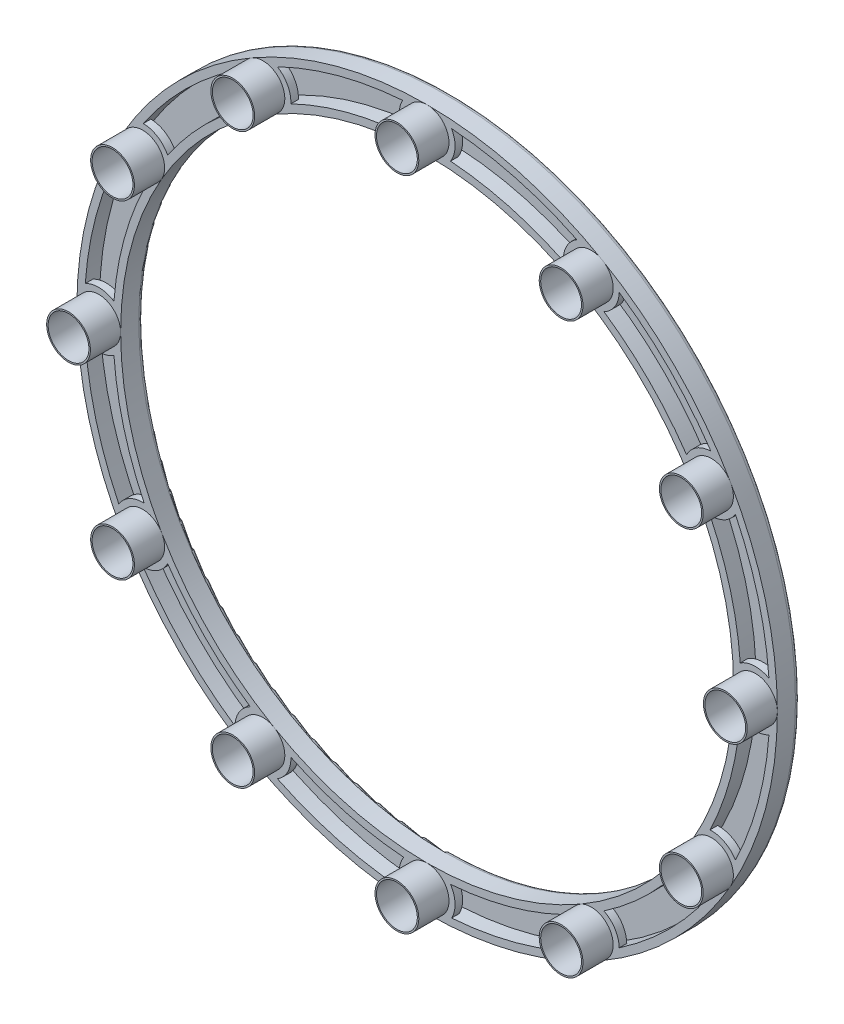
from build123d import *

# Parameters (mm, degrees)
SKETCH1_R                        = 36.83
BOSS_EXTRUDE8_DEPTH              = 50.8
BOSS_EXTRUDE8_2_DEPTH            = 50.8
BOSS_EXTRUDE8_3_DEPTH            = 50.8
BOSS_EXTRUDE8_4_DEPTH            = 50.8
BOSS_EXTRUDE8_5_DEPTH            = 50.8
BOSS_EXTRUDE8_6_DEPTH            = 50.8
BOSS_EXTRUDE8_7_DEPTH            = 50.8
BOSS_EXTRUDE8_8_DEPTH            = 50.8
BOSS_EXTRUDE8_9_DEPTH            = 50.8
BOSS_EXTRUDE8_10_DEPTH           = 50.8
BOSS_EXTRUDE8_11_DEPTH           = 50.8
BOSS_EXTRUDE8_12_DEPTH           = 50.8
SKETCH14_W                       = 34.330005
SKETCH14_H                       = 71.12
F_1_1_DIAMETER_HOLE1_AT_2_COUNT  = 2
F_1_1_DIAMETER_HOLE1_AT_2_PITCH  = 285.969162934
F_1_1_DIAMETER_HOLE1_AT_3_COUNT  = 2
F_1_1_DIAMETER_HOLE1_AT_3_PITCH  = 552.45
F_1_1_DIAMETER_HOLE1_AT_4_COUNT  = 2
F_1_1_DIAMETER_HOLE1_AT_4_PITCH  = 781.282282533
F_1_1_DIAMETER_HOLE1_AT_5_COUNT  = 2
F_1_1_DIAMETER_HOLE1_AT_5_PITCH  = 956.871468641
F_1_1_DIAMETER_HOLE1_AT_6_COUNT  = 2
F_1_1_DIAMETER_HOLE1_AT_6_PITCH  = 1067.251445467
F_1_1_DIAMETER_HOLE1_AT_7_COUNT  = 2
F_1_1_DIAMETER_HOLE1_AT_7_PITCH  = 1104.9
F_1_1_DIAMETER_HOLE1_AT_8_COUNT  = 2
F_1_1_DIAMETER_HOLE1_AT_8_PITCH  = 1067.251445467
F_1_1_DIAMETER_HOLE1_AT_9_COUNT  = 2
F_1_1_DIAMETER_HOLE1_AT_9_PITCH  = 956.871468641
F_1_1_DIAMETER_HOLE1_AT_10_COUNT = 2
F_1_1_DIAMETER_HOLE1_AT_10_PITCH = 781.282282533
F_1_1_DIAMETER_HOLE1_AT_11_COUNT = 2
F_1_1_DIAMETER_HOLE1_AT_11_PITCH = 552.45
F_1_1_DIAMETER_HOLE1_AT_12_COUNT = 2
F_1_1_DIAMETER_HOLE1_AT_12_PITCH = 285.969162934
SKETCH7_R                        = 589.28
SKETCH7_R_2                      = 515.62
BOSS_EXTRUDE9_DEPTH              = 38.1
FILLET1_R                        = 7.62
SHELL1_START                     = 50.8
SHELL1_DEPTH                     = 25.4
SHELL1_START_2                   = 63.5
SHELL1_2_DEPTH                   = 12.7
F_1_1_DIAMETER_HOLE2_D           = 68.66001
F_1_1_DIAMETER_HOLE2_DEPTH       = 12.7
SCALE3_SCALE                     = 0.97
SCALE5_SCALE                     = 1.01
SCALE8_SCALE                     = 0.98
BODY_MOVE_COPY1_ANGLE            = 180


# Read off the part's stored shape, not the designer's step: Shell1
with BuildPart() as part:
    # Sketch1 → Boss-Extrude8 (new body)
    with BuildSketch(Plane.XY):
        with Locations((0, 552.45)):
            Circle(SKETCH1_R)
    extrude(amount=BOSS_EXTRUDE8_DEPTH)


with BuildPart() as body_2:
    # Sketch1 → Boss-Extrude8 2 (new body)
    with BuildSketch(Plane.XY):
        with Locations((276.225, 478.435734321)):
            Circle(SKETCH1_R)
    extrude(amount=BOSS_EXTRUDE8_2_DEPTH)


with BuildPart() as body_3:
    # Sketch1 → Boss-Extrude8 3 (new body)
    with BuildSketch(Plane.XY):
        with Locations((478.435734321, 276.225)):
            Circle(SKETCH1_R)
    extrude(amount=BOSS_EXTRUDE8_3_DEPTH)


with BuildPart() as body_4:
    # Sketch1 → Boss-Extrude8 4 (new body)
    with BuildSketch(Plane.XY):
        with Locations((552.45, 0)):
            Circle(SKETCH1_R)
    extrude(amount=BOSS_EXTRUDE8_4_DEPTH)


with BuildPart() as body_5:
    # Sketch1 → Boss-Extrude8 5 (new body)
    with BuildSketch(Plane.XY):
        with Locations((478.435734321, -276.225)):
            Circle(SKETCH1_R)
    extrude(amount=BOSS_EXTRUDE8_5_DEPTH)

    # Sketch14 → 1 (1) Diameter Hole1 (revolve, cut)
    with BuildSketch(Plane(origin=(478.435734321, -276.225, 50.8), x_dir=(0, -1, 0), z_dir=(1, 0, 0))):
        with Locations((17.1650025, 35.56)):
            Rectangle(SKETCH14_W, SKETCH14_H)
    f_1_1_diameter_hole1 = revolve(axis=Axis((478.435734321, -276.225, 57.15), (0, 0, -1)), mode=Mode.SUBTRACT)


with BuildPart() as body_6:
    # Sketch1 → Boss-Extrude8 6 (new body)
    with BuildSketch(Plane.XY):
        with Locations((276.225, -478.435734321)):
            Circle(SKETCH1_R)
    extrude(amount=BOSS_EXTRUDE8_6_DEPTH)

    # 1 (1) Diameter Hole1 at 2: 1 (1) Diameter Hole1 ×2
    with Locations(*[Vector(-0.7071067811865175, -0.7071067811865775, 0) * (i * F_1_1_DIAMETER_HOLE1_AT_2_PITCH) for i in range(1, F_1_1_DIAMETER_HOLE1_AT_2_COUNT)]):
        add(f_1_1_diameter_hole1, mode=Mode.SUBTRACT)


with BuildPart() as body_7:
    # Sketch1 → Boss-Extrude8 7 (new body)
    with BuildSketch(Plane.XY):
        with Locations((0, -552.45)):
            Circle(SKETCH1_R)
    extrude(amount=BOSS_EXTRUDE8_7_DEPTH)

    # 1 (1) Diameter Hole1 at 3: 1 (1) Diameter Hole1 ×2
    with Locations(*[Vector(-0.8660254037844174, -0.500000000000037, 0) * (i * F_1_1_DIAMETER_HOLE1_AT_3_PITCH) for i in range(1, F_1_1_DIAMETER_HOLE1_AT_3_COUNT)]):
        add(f_1_1_diameter_hole1, mode=Mode.SUBTRACT)


with BuildPart() as body_8:
    # Sketch1 → Boss-Extrude8 8 (new body)
    with BuildSketch(Plane.XY):
        with Locations((-276.225, -478.435734321)):
            Circle(SKETCH1_R)
    extrude(amount=BOSS_EXTRUDE8_8_DEPTH)

    # 1 (1) Diameter Hole1 at 4: 1 (1) Diameter Hole1 ×2
    with Locations(*[Vector(-0.9659258262890572, -0.25881904510256215, 0) * (i * F_1_1_DIAMETER_HOLE1_AT_4_PITCH) for i in range(1, F_1_1_DIAMETER_HOLE1_AT_4_COUNT)]):
        add(f_1_1_diameter_hole1, mode=Mode.SUBTRACT)


with BuildPart() as body_9:
    # Sketch1 → Boss-Extrude8 9 (new body)
    with BuildSketch(Plane.XY):
        with Locations((-478.435734321, -276.225)):
            Circle(SKETCH1_R)
    extrude(amount=BOSS_EXTRUDE8_9_DEPTH)

    # 1 (1) Diameter Hole1 at 5: 1 (1) Diameter Hole1 ×2
    with Locations(*[(-i * F_1_1_DIAMETER_HOLE1_AT_5_PITCH, 0, 0) for i in range(1, F_1_1_DIAMETER_HOLE1_AT_5_COUNT)]):
        add(f_1_1_diameter_hole1, mode=Mode.SUBTRACT)


with BuildPart() as body_10:
    # Sketch1 → Boss-Extrude8 10 (new body)
    with BuildSketch(Plane.XY):
        with Locations((-552.45, 0)):
            Circle(SKETCH1_R)
    extrude(amount=BOSS_EXTRUDE8_10_DEPTH)

    # 1 (1) Diameter Hole1 at 6: 1 (1) Diameter Hole1 ×2
    with Locations(*[Vector(-0.9659258262890794, 0.25881904510247955, 0) * (i * F_1_1_DIAMETER_HOLE1_AT_6_PITCH) for i in range(1, F_1_1_DIAMETER_HOLE1_AT_6_COUNT)]):
        add(f_1_1_diameter_hole1, mode=Mode.SUBTRACT)


with BuildPart() as body_11:
    # Sketch1 → Boss-Extrude8 11 (new body)
    with BuildSketch(Plane.XY):
        with Locations((-478.435734321, 276.225)):
            Circle(SKETCH1_R)
    extrude(amount=BOSS_EXTRUDE8_11_DEPTH)

    # 1 (1) Diameter Hole1 at 7: 1 (1) Diameter Hole1 ×2
    with Locations(*[Vector(-0.8660254037844601, 0.49999999999996275, 0) * (i * F_1_1_DIAMETER_HOLE1_AT_7_PITCH) for i in range(1, F_1_1_DIAMETER_HOLE1_AT_7_COUNT)]):
        add(f_1_1_diameter_hole1, mode=Mode.SUBTRACT)


with BuildPart() as body_12:
    # Sketch1 → Boss-Extrude8 12 (new body)
    with BuildSketch(Plane.XY):
        with Locations((-276.225, 478.435734321)):
            Circle(SKETCH1_R)
    extrude(amount=BOSS_EXTRUDE8_12_DEPTH)

    # 1 (1) Diameter Hole1 at 8: 1 (1) Diameter Hole1 ×2
    with Locations(*[Vector(-0.7071067811865779, 0.7071067811865172, 0) * (i * F_1_1_DIAMETER_HOLE1_AT_8_PITCH) for i in range(1, F_1_1_DIAMETER_HOLE1_AT_8_COUNT)]):
        add(f_1_1_diameter_hole1, mode=Mode.SUBTRACT)


with BuildPart() as part_1:
    add(part.part)

    # 1 (1) Diameter Hole1 at 9: 1 (1) Diameter Hole1 ×2
    with Locations(*[Vector(-0.500000000000037, 0.8660254037844173, 0) * (i * F_1_1_DIAMETER_HOLE1_AT_9_PITCH) for i in range(1, F_1_1_DIAMETER_HOLE1_AT_9_COUNT)]):
        add(f_1_1_diameter_hole1, mode=Mode.SUBTRACT)



with BuildPart() as body_2_1:
    add(body_2.part)

    # 1 (1) Diameter Hole1 at 10: 1 (1) Diameter Hole1 ×2
    with Locations(*[Vector(-0.258819045102569, 0.9659258262890553, 0) * (i * F_1_1_DIAMETER_HOLE1_AT_10_PITCH) for i in range(1, F_1_1_DIAMETER_HOLE1_AT_10_COUNT)]):
        add(f_1_1_diameter_hole1, mode=Mode.SUBTRACT)


with BuildPart() as body_3_1:
    add(body_3.part)

    # 1 (1) Diameter Hole1 at 11: 1 (1) Diameter Hole1 ×2
    with Locations(*[(0, i * F_1_1_DIAMETER_HOLE1_AT_11_PITCH, 0) for i in range(1, F_1_1_DIAMETER_HOLE1_AT_11_COUNT)]):
        add(f_1_1_diameter_hole1, mode=Mode.SUBTRACT)


with BuildPart() as body_4_1:
    add(body_4.part)

    # 1 (1) Diameter Hole1 at 12: 1 (1) Diameter Hole1 ×2
    with Locations(*[Vector(0.2588190451024793, 0.9659258262890795, 0) * (i * F_1_1_DIAMETER_HOLE1_AT_12_PITCH) for i in range(1, F_1_1_DIAMETER_HOLE1_AT_12_COUNT)]):
        add(f_1_1_diameter_hole1, mode=Mode.SUBTRACT)


with BuildPart() as part_2:
    add(part_1.part)

    add(body_2_1.part)  # Boss-Extrude9 merges body 2

    add(body_3_1.part)  # Boss-Extrude9 merges body 3

    add(body_4_1.part)  # Boss-Extrude9 merges body 4

    add(body_5.part)  # Boss-Extrude9 merges body 5

    add(body_6.part)  # Boss-Extrude9 merges body 6

    add(body_7.part)  # Boss-Extrude9 merges body 7

    add(body_8.part)  # Boss-Extrude9 merges body 8

    add(body_9.part)  # Boss-Extrude9 merges body 9

    add(body_10.part)  # Boss-Extrude9 merges body 10

    add(body_11.part)  # Boss-Extrude9 merges body 11

    add(body_12.part)  # Boss-Extrude9 merges body 12
    # Sketch7 → Boss-Extrude9 (add)
    with BuildSketch(Plane.XY.offset(50.8)):
        Circle(SKETCH7_R)
        Circle(SKETCH7_R_2, mode=Mode.SUBTRACT)
    extrude(amount=BOSS_EXTRUDE9_DEPTH)

    # Fillet1
    fillet1_edges = [part_2.edges().sort_by_distance(p)[0] for p in [
        (-589.28, 0, 88.9),
        (-515.62, 0, 88.9),
    ]]
    fillet(fillet1_edges, radius=FILLET1_R)

    # Shell1 outline → Shell1 (cut)
    with BuildSketch(Plane.XY.offset(SHELL1_START)):
        with BuildLine():
            ThreePointArc((475.985713833, 229.258855067), (510.317932545, 136.739277909), (526.845147552, 39.448864387))
            ThreePointArc((526.845147552, 39.448864387), (550.731333527, 46.998590999), (575.105147552, 41.213658655))
            ThreePointArc((575.105147552, 41.213658655), (556.933512922, 149.229885025), (518.662496954, 251.860498398))
            ThreePointArc((518.662496954, 251.860498398), (500.446620993, 234.663693016), (475.985713833, 229.258855067))
        make_face()
        with BuildLine():
            ThreePointArc((575.105147552, -41.213658655), (550.731333527, -46.998590999), (526.845147552, -39.448864387))
            ThreePointArc((526.845147552, -39.448864387), (510.317932545, -136.739277909), (475.985713833, -229.258855067))
            ThreePointArc((475.985713833, -229.258855067), (500.446620994, -234.663693016), (518.662496954, -251.860498398))
            ThreePointArc((518.662496954, -251.860498398), (556.933512922, -149.229885025), (575.105147552, -41.213658655))
        make_face()
        with BuildLine():
            ThreePointArc((297.586292485, 436.536849447), (373.578654636, 373.578654636), (436.536849447, 297.586292485))
            ThreePointArc((436.536849447, 297.586292485), (453.448029995, 316.06764051), (477.448838299, 323.244649154))
            ThreePointArc((477.448838299, 323.244649154), (407.703627897, 407.703627897), (323.244649154, 477.448838299))
            ThreePointArc((323.244649154, 477.448838299), (316.06764051, 453.448029995), (297.586292485, 436.536849447))
        make_face()
        with BuildLine():
            ThreePointArc((477.448838299, -323.244649154), (453.448029995, -316.06764051), (436.536849447, -297.586292485))
            ThreePointArc((436.536849447, -297.586292485), (373.578654636, -373.578654636), (297.586292485, -436.536849447))
            ThreePointArc((297.586292485, -436.536849447), (316.06764051, -453.448029995), (323.244649154, -477.448838299))
            ThreePointArc((323.244649154, -477.448838299), (407.703627897, -407.703627897), (477.448838299, -323.244649154))
        make_face()
        with BuildLine():
            ThreePointArc((39.448864387, 526.845147552), (136.739277909, 510.317932545), (229.258855067, 475.985713833))
            ThreePointArc((229.258855067, 475.985713833), (234.663693016, 500.446620993), (251.860498398, 518.662496954))
            ThreePointArc((251.860498398, 518.662496954), (149.229885025, 556.933512922), (41.213658655, 575.105147552))
            ThreePointArc((41.213658655, 575.105147552), (46.998590999, 550.731333527), (39.448864387, 526.845147552))
        make_face()
        with BuildLine():
            ThreePointArc((251.860498398, -518.662496954), (234.663693016, -500.446620993), (229.258855067, -475.985713833))
            ThreePointArc((229.258855067, -475.985713833), (136.739277909, -510.317932545), (39.448864387, -526.845147552))
            ThreePointArc((39.448864387, -526.845147552), (46.998590999, -550.731333527), (41.213658655, -575.105147552))
            ThreePointArc((41.213658655, -575.105147552), (149.229885025, -556.933512922), (251.860498398, -518.662496954))
        make_face()
        with BuildLine():
            ThreePointArc((-229.258855067, 475.985713833), (-136.739277909, 510.317932545), (-39.448864387, 526.845147552))
            ThreePointArc((-39.448864387, 526.845147552), (-46.998590999, 550.731333527), (-41.213658655, 575.105147552))
            ThreePointArc((-41.213658655, 575.105147552), (-149.229885025, 556.933512922), (-251.860498398, 518.662496954))
            ThreePointArc((-251.860498398, 518.662496954), (-234.663693016, 500.446620994), (-229.258855067, 475.985713833))
        make_face()
        with BuildLine():
            ThreePointArc((-41.213658655, -575.105147552), (-46.998590999, -550.731333527), (-39.448864387, -526.845147552))
            ThreePointArc((-39.448864387, -526.845147552), (-136.739277908, -510.317932545), (-229.258855066, -475.985713834))
            ThreePointArc((-229.258855066, -475.985713834), (-234.663693016, -500.446620994), (-251.860498398, -518.662496954))
            ThreePointArc((-251.860498398, -518.662496954), (-149.229885025, -556.933512922), (-41.213658655, -575.105147552))
        make_face()
        with BuildLine():
            ThreePointArc((-436.536849447, 297.586292485), (-373.578654636, 373.578654636), (-297.586292485, 436.536849447))
            ThreePointArc((-297.586292485, 436.536849447), (-316.06764051, 453.448029995), (-323.244649154, 477.448838299))
            ThreePointArc((-323.244649154, 477.448838299), (-407.703627897, 407.703627897), (-477.448838299, 323.244649154))
            ThreePointArc((-477.448838299, 323.244649154), (-453.448029995, 316.06764051), (-436.536849447, 297.586292485))
        make_face()
        with BuildLine():
            ThreePointArc((-323.244649154, -477.448838299), (-316.06764051, -453.448029995), (-297.586292485, -436.536849447))
            ThreePointArc((-297.586292485, -436.536849447), (-373.578654636, -373.578654636), (-436.536849447, -297.586292485))
            ThreePointArc((-436.536849447, -297.586292485), (-453.448029995, -316.06764051), (-477.448838299, -323.244649154))
            ThreePointArc((-477.448838299, -323.244649154), (-407.703627897, -407.703627897), (-323.244649154, -477.448838299))
        make_face()
        with BuildLine():
            ThreePointArc((-526.845147552, 39.448864387), (-510.317932545, 136.739277909), (-475.985713833, 229.258855067))
            ThreePointArc((-475.985713833, 229.258855067), (-500.446620994, 234.663693016), (-518.662496954, 251.860498398))
            ThreePointArc((-518.662496954, 251.860498398), (-556.933512922, 149.229885025), (-575.105147552, 41.213658655))
            ThreePointArc((-575.105147552, 41.213658655), (-550.731333527, 46.998590999), (-526.845147552, 39.448864387))
        make_face()
        with BuildLine():
            ThreePointArc((-518.662496954, -251.860498398), (-500.446620993, -234.663693016), (-475.985713833, -229.258855067))
            ThreePointArc((-475.985713833, -229.258855067), (-510.317932545, -136.739277909), (-526.845147552, -39.448864387))
            ThreePointArc((-526.845147552, -39.448864387), (-550.731333527, -46.998590999), (-575.105147552, -41.213658655))
            ThreePointArc((-575.105147552, -41.213658655), (-556.933512922, -149.229885025), (-518.662496954, -251.860498398))
        make_face()
    extrude(amount=SHELL1_DEPTH, mode=Mode.SUBTRACT)

    # Shell1 2 outline → Shell1 2 (cut)
    with BuildSketch(Plane.XY.offset(SHELL1_START_2)):
        with BuildLine():
            ThreePointArc((526.845147552, 39.448864387), (528.32, 0), (526.845147552, -39.448864387))
            ThreePointArc((526.845147552, -39.448864387), (550.731333527, -46.998590999), (575.105147552, -41.213658655))
            ThreePointArc((575.105147552, -41.213658655), (576.58, 0), (575.105147552, 41.213658655))
            ThreePointArc((575.105147552, 41.213658655), (550.731333527, 46.998590999), (526.845147552, 39.448864387))
        make_face()
        with BuildLine():
            ThreePointArc((436.536849447, 297.586292485), (457.538541327, 264.16), (475.985713833, 229.258855067))
            ThreePointArc((475.985713833, 229.258855067), (500.446620993, 234.663693016), (518.662496954, 251.860498398))
            ThreePointArc((518.662496954, 251.860498398), (499.332927314, 288.29), (477.448838299, 323.244649154))
            ThreePointArc((477.448838299, 323.244649154), (453.448029995, 316.06764051), (436.536849447, 297.586292485))
        make_face()
        with BuildLine():
            ThreePointArc((518.662496954, -251.860498398), (500.446620994, -234.663693016), (475.985713834, -229.258855067))
            ThreePointArc((475.985713834, -229.258855067), (457.538541327, -264.16), (436.536849447, -297.586292485))
            ThreePointArc((436.536849447, -297.586292485), (453.448029995, -316.06764051), (477.448838299, -323.244649154))
            ThreePointArc((477.448838299, -323.244649154), (499.332927314, -288.29), (518.662496954, -251.860498398))
        make_face()
        with BuildLine():
            ThreePointArc((229.258855067, 475.985713833), (264.16, 457.538541327), (297.586292485, 436.536849447))
            ThreePointArc((297.586292485, 436.536849447), (316.06764051, 453.448029995), (323.244649154, 477.448838299))
            ThreePointArc((323.244649154, 477.448838299), (288.29, 499.332927314), (251.860498398, 518.662496954))
            ThreePointArc((251.860498398, 518.662496954), (234.663693016, 500.446620993), (229.258855067, 475.985713833))
        make_face()
        with BuildLine():
            ThreePointArc((323.244649154, -477.448838299), (316.06764051, -453.448029995), (297.586292485, -436.536849447))
            ThreePointArc((297.586292485, -436.536849447), (264.16, -457.538541327), (229.258855067, -475.985713833))
            ThreePointArc((229.258855067, -475.985713833), (234.663693016, -500.446620993), (251.860498398, -518.662496954))
            ThreePointArc((251.860498398, -518.662496954), (288.29, -499.332927314), (323.244649154, -477.448838299))
        make_face()
        with BuildLine():
            ThreePointArc((-39.448864387, 526.845147552), (0, 528.32), (39.448864387, 526.845147552))
            ThreePointArc((39.448864387, 526.845147552), (46.998590999, 550.731333527), (41.213658655, 575.105147552))
            ThreePointArc((41.213658655, 575.105147552), (0, 576.58), (-41.213658655, 575.105147552))
            ThreePointArc((-41.213658655, 575.105147552), (-46.998590999, 550.731333527), (-39.448864387, 526.845147552))
        make_face()
        with BuildLine():
            ThreePointArc((41.213658655, -575.105147552), (46.998590999, -550.731333527), (39.448864387, -526.845147552))
            ThreePointArc((39.448864387, -526.845147552), (0, -528.32), (-39.448864387, -526.845147552))
            ThreePointArc((-39.448864387, -526.845147552), (-46.998590999, -550.731333527), (-41.213658655, -575.105147552))
            ThreePointArc((-41.213658655, -575.105147552), (0, -576.58), (41.213658655, -575.105147552))
        make_face()
        with BuildLine():
            ThreePointArc((-297.586292485, 436.536849447), (-264.16, 457.538541327), (-229.258855067, 475.985713833))
            ThreePointArc((-229.258855067, 475.985713833), (-234.663693016, 500.446620994), (-251.860498398, 518.662496954))
            ThreePointArc((-251.860498398, 518.662496954), (-288.29, 499.332927314), (-323.244649154, 477.448838299))
            ThreePointArc((-323.244649154, 477.448838299), (-316.06764051, 453.448029995), (-297.586292485, 436.536849447))
        make_face()
        with BuildLine():
            ThreePointArc((-251.860498398, -518.662496954), (-234.663693016, -500.446620994), (-229.258855066, -475.985713834))
            ThreePointArc((-229.258855066, -475.985713834), (-264.16, -457.538541328), (-297.586292485, -436.536849447))
            ThreePointArc((-297.586292485, -436.536849447), (-316.06764051, -453.448029995), (-323.244649154, -477.448838299))
            ThreePointArc((-323.244649154, -477.448838299), (-288.29, -499.332927314), (-251.860498398, -518.662496954))
        make_face()
        with BuildLine():
            ThreePointArc((-475.985713833, 229.258855067), (-457.538541327, 264.16), (-436.536849447, 297.586292485))
            ThreePointArc((-436.536849447, 297.586292485), (-453.448029995, 316.06764051), (-477.448838299, 323.244649154))
            ThreePointArc((-477.448838299, 323.244649154), (-499.332927314, 288.29), (-518.662496954, 251.860498398))
            ThreePointArc((-518.662496954, 251.860498398), (-500.446620994, 234.663693016), (-475.985713833, 229.258855067))
        make_face()
        with BuildLine():
            ThreePointArc((-477.448838299, -323.244649154), (-453.448029995, -316.06764051), (-436.536849447, -297.586292485))
            ThreePointArc((-436.536849447, -297.586292485), (-457.538541327, -264.16), (-475.985713833, -229.258855067))
            ThreePointArc((-475.985713833, -229.258855067), (-500.446620993, -234.663693016), (-518.662496954, -251.860498398))
            ThreePointArc((-518.662496954, -251.860498398), (-499.332927314, -288.29), (-477.448838299, -323.244649154))
        make_face()
        with BuildLine():
            ThreePointArc((-526.845147552, -39.448864387), (-528.32, 0), (-526.845147552, 39.448864387))
            ThreePointArc((-526.845147552, 39.448864387), (-550.731333527, 46.998590999), (-575.105147552, 41.213658655))
            ThreePointArc((-575.105147552, 41.213658655), (-576.58, 0), (-575.105147552, -41.213658655))
            ThreePointArc((-575.105147552, -41.213658655), (-550.731333527, -46.998590999), (-526.845147552, -39.448864387))
        make_face()
    extrude(amount=SHELL1_2_DEPTH, mode=Mode.SUBTRACT)

    # 1 (1) Diameter Hole2
    with Locations(Plane(origin=(0, 0, 50.8), x_dir=(-1, 0, 0), z_dir=(0, 0, -1))):
        with Locations((276.225, 478.435734321), (0, 552.45), (-276.225, 478.435734321), (478.435734321, 276.225), (-478.435734321, 276.225), (-552.45, 0), (-478.435734321, -276.225), (-276.225, -478.435734321), (0, -552.45), (276.225, -478.435734321), (478.435734321, -276.225), (552.45, 0)):
            Hole(F_1_1_DIAMETER_HOLE2_D / 2, depth=F_1_1_DIAMETER_HOLE2_DEPTH)


with BuildPart() as part_3:
    # Scale3: scaled about (0, 0, 71.418524043)
    add(part_2.part.scale(SCALE3_SCALE).moved(Location((0, 0, 2.142555721))))


with BuildPart() as part_4:
    # Scale5: scaled about (0, 0, 71.418524043)
    add(part_3.part.scale(SCALE5_SCALE).moved(Location((0, 0, -0.71418524))))


with BuildPart() as part_5:
    # Scale8: scaled about (0, 0, 71.418524043)
    add(part_4.part.scale(SCALE8_SCALE).moved(Location((0, 0, 1.428370481))))


with BuildPart() as part_6:
    # Body-Move/Copy1: moved
    add(part_5.part.rotate(Axis((-2e-08, 0, 45.525881931), (0, 1, 0)), BODY_MOVE_COPY1_ANGLE))


solid = part_6.part
